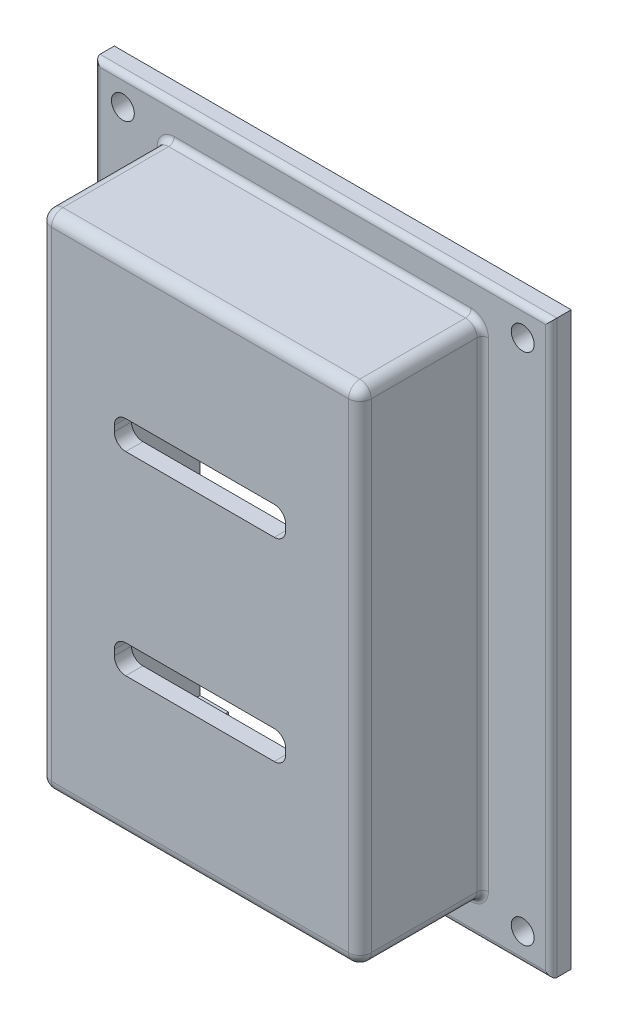
from build123d import *

# Parameters (mm, degrees)
SKETCH1_W             = 80
SKETCH1_H             = 100
BOSS_EXTRUDE1_DEPTH   = 3.5
SKETCH3_W             = 56
SKETCH3_H             = 88
BOSS_EXTRUDE2_DEPTH   = 21.5
SKETCH4_W             = 50
SKETCH4_H             = 82
CUT_EXTRUDE4_DEPTH    = 16
CUT_EXTRUDE5_DEPTH    = 6
SKETCH8_W             = 30
SKETCH8_H             = 5
CUT_EXTRUDE6_DEPTH    = 6
CUT_EXTRUDE7_REACH    = 112.567
SKETCH9_W             = 40
SKETCH9_H             = 12
F_4_0MM_DOWEL_HOLE1_D = 4
FILLET1_R             = 7
FILLET2_R             = 2
FILLET3_R             = 1
FILLET4_R             = 2


# Some blends are built 0.0001 mm under size
with BuildPart() as part:
    # Sketch1 → Boss-Extrude1 (new body)
    with BuildSketch(Plane.XY):
        Rectangle(SKETCH1_W, SKETCH1_H)
    extrude(amount=BOSS_EXTRUDE1_DEPTH)

    # Sketch3 → Boss-Extrude2 (add)
    with BuildSketch(Plane.XY.offset(3.5)):
        Rectangle(SKETCH3_W, SKETCH3_H)
    extrude(amount=BOSS_EXTRUDE2_DEPTH)

    # Sketch4 → Cut-Extrude4 (cut)
    with BuildSketch(Plane(origin=(0, 0, 0), x_dir=(-1, 0, 0), z_dir=(0, 0, -1))):
        Rectangle(SKETCH4_W, SKETCH4_H)
    extrude(amount=-CUT_EXTRUDE4_DEPTH, mode=Mode.SUBTRACT)

    # Sketch7 → Cut-Extrude5 (cut)
    with BuildSketch(Plane(origin=(0, 0, 16), x_dir=(-1, 0, 0), z_dir=(0, 0, -1))):
        Polygon((-18, 41), (18, 41), (18, 34), (25, 34), (25, -34), (18, -34), (18, -41), (-18, -41), (-18, -34), (-25, -34), (-25, 34), (-18, 34), align=None)
    extrude(amount=-CUT_EXTRUDE5_DEPTH, mode=Mode.SUBTRACT)

    # Sketch8 → Cut-Extrude6 (cut)
    with BuildSketch(Plane.XY.offset(25)):
        with Locations((0, -17)):
            Rectangle(SKETCH8_W, SKETCH8_H)
    cut_extrude6 = extrude(amount=-CUT_EXTRUDE6_DEPTH, mode=Mode.SUBTRACT)

    # Mirror1: Cut-Extrude6 across plane
    add(cut_extrude6.mirror(Plane.ZX), mode=Mode.SUBTRACT)

    # Sketch9 → Cut-Extrude7 (cut, up to next)
    with BuildSketch(Plane.XZ.offset(50), mode=Mode.PRIVATE) as cut_extrude7_sk1:
        with Locations((0, 6)):
            Rectangle(SKETCH9_W, SKETCH9_H)
    cut_extrude7_tool1 = extrude(cut_extrude7_sk1.sketch, amount=-CUT_EXTRUDE7_REACH, mode=Mode.PRIVATE) & part.part
    add(cut_extrude7_tool1.solids().sort_by_distance((0, -50, 6))[0], mode=Mode.SUBTRACT)

    # Ø4.0mm Dowel Hole1 (through all)
    with Locations(Plane(origin=(0, 0, 0), x_dir=(-1, 0, 0), z_dir=(0, 0, -1))):
        with Locations((-35, 45), (35, 45), (35, -45), (-35, -45)):
            Hole(F_4_0MM_DOWEL_HOLE1_D / 2)

    # Fillet1
    fillet1_edges = [part.edges().sort_by_distance(p)[0] for p in [
        (-18, 34, 19),
        (18, 34, 19),
        (18, -34, 19),
        (-18, -34, 19),
    ]]
    fillet(fillet1_edges, radius=FILLET1_R - 0.0001)  # a hair under: the kernel refuses the full size

    # Fillet2
    fillet2_edges = [part.edges().sort_by_distance(p)[0] for p in [
        (28, -44, 14.25),
        (28, 44, 14.25),
        (-28, 44, 14.25),
        (-28, -44, 14.25),
        (28, 0, 25),
        (0, 44, 25),
        (-28, 0, 25),
        (15, -14.5, 23.5),
        (15, -19.5, 23.5),
        (-15, -19.5, 23.5),
        (-15, -14.5, 23.5),
        (15, 19.5, 23.5),
        (15, 14.5, 23.5),
        (-15, 14.5, 23.5),
        (-15, 19.5, 23.5),
    ]]
    fillet(fillet2_edges, radius=FILLET2_R)

    # Fillet3
    fillet3_edges = [part.edges().sort_by_distance(p)[0] for p in [
        (-40, 0, 3.5),
        (23, -44, 3.5),
        (30, -50, 3.5),
        (-30, -50, 3.5),
        (28, 0, 3.5),
        (-23, -44, 3.5),
        (-28, 0, 3.5),
        (0, 44, 3.5),
        (27.414213562, -43.414213562, 3.5),
        (-27.414213562, -43.414213562, 3.5),
        (-27.414213562, 43.414213562, 3.5),
        (27.414213562, 43.414213562, 3.5),
        (40, 0, 3.5),
        (0, 50, 3.5),
    ]]
    fillet(fillet3_edges, radius=FILLET3_R)

    # Fillet4
    # the kernel refuses this fillet: 2 mm, written as the material it takes off along each edge
    with BuildSketch(Plane(origin=(-26, -42, 23), x_dir=(0, 0, 1), z_dir=(0, -1, 0))) as fillet4_piece_1_section:
        Polygon((0, 0), (FILLET4_R, 0), (FILLET4_R, FILLET4_R), (0, FILLET4_R), align=None)
    fillet4_piece_1 = extrude(amount=FILLET4_R, mode=Mode.PRIVATE)
    fillet4_piece_1 = fillet4_piece_1 - Plane(origin=(-26, -42, 23), x_dir=(0.7071067811865475, 0, -0.7071067811865475), z_dir=(0, -1, 0)) * Sphere(FILLET4_R, mode=Mode.PRIVATE)
    add(fillet4_piece_1, mode=Mode.SUBTRACT)
    with BuildSketch(Plane(origin=(26, -42, 23), x_dir=(0, 0, 1), z_dir=(0, -1, 0))) as fillet4_piece_2_section:
        Polygon((0, 0), (FILLET4_R, 0), (FILLET4_R, -FILLET4_R), (0, -FILLET4_R), align=None)
    fillet4_piece_2 = extrude(amount=FILLET4_R, mode=Mode.PRIVATE)
    fillet4_piece_2 = fillet4_piece_2 - Plane(origin=(26, -42, 23), x_dir=(-0.7071067811865475, 0, -0.7071067811865475), z_dir=(0, -1, 0)) * Sphere(FILLET4_R, mode=Mode.PRIVATE)
    add(fillet4_piece_2, mode=Mode.SUBTRACT)
    with BuildSketch(Plane(origin=(26, -44, 25), x_dir=(0, 0, -1), z_dir=(-1, 0, 0))) as fillet4_piece_3:
        with BuildLine():
            CenterArc((FILLET4_R, -FILLET4_R), FILLET4_R, 90, 90)
            Line((0, -FILLET4_R), (0, 0))
            Line((0, 0), (FILLET4_R, 0))
        make_face()
    extrude(amount=52, mode=Mode.SUBTRACT)


solid = part.part
